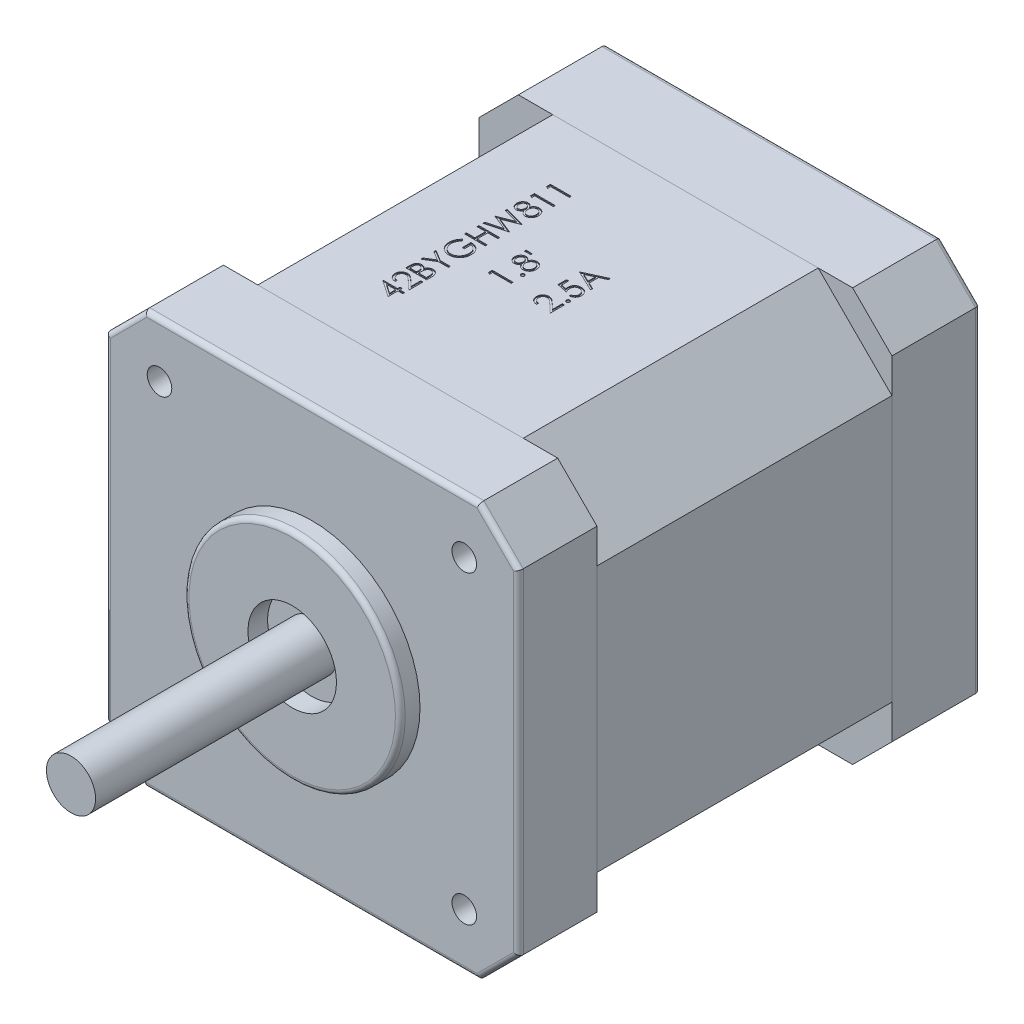
from build123d import *

# Parameters (mm, degrees)
IZIM1_R                     = 2.5
Y_KSEKLIK_EKSTR_ZYON1_DEPTH = 24.5
IZIM1_4_R                   = 11
IZIM1_4_R_2                 = 4.5
Y_KSEKLIK_EKSTR_ZYON2_DEPTH = 2
IZIM1_5_W                   = 42
IZIM1_5_H                   = 42
Y_KSEKLIK_EKSTR_ZYON3_DEPTH = 8
PAH1_SIZE                   = 4
Y_KSEKLIK_EKSTR_ZYON4_DEPTH = 30
Y_KSEKLIK_EKSTR_ZYON5_DEPTH = 9
IZIM4_R                     = 4.5
KES_EKSTR_ZYON1_DEPTH       = 3.5
M3_DI_LI_DELIK1_D           = 2.5
M3_DI_LI_DELIK1_DEPTH       = 7
M3_DI_LI_DELIK1_TIP         = 0.751075774
RADYUS1_R                   = 0.5
RADYUS2_R                   = 0.5
KES_EKSTR_ZYON2_DEPTH       = 0.1
IZIM11_R                    = 0.6


with BuildPart() as part:
    # Çizim1 → Yükseklik-Ekstrüzyon1 (new body)
    with BuildSketch(Plane.XY):
        Circle(IZIM1_R)
    extrude(amount=Y_KSEKLIK_EKSTR_ZYON1_DEPTH)



with BuildPart() as body_2:
    # Çizim1<4> → Yükseklik-Ekstrüzyon2 (new body)
    with BuildSketch(Plane.XY):
        Circle(IZIM1_4_R)
        Circle(IZIM1_4_R_2, mode=Mode.SUBTRACT)
    extrude(amount=Y_KSEKLIK_EKSTR_ZYON2_DEPTH)


with BuildPart() as part_1:
    add(part.part)

    add(body_2.part)  # Yükseklik-Ekstrüzyon3 merges body 2
    # Çizim1<5> → Yükseklik-Ekstrüzyon3 (add)
    with BuildSketch(Plane.XY):
        Rectangle(IZIM1_5_W, IZIM1_5_H)
    extrude(amount=-Y_KSEKLIK_EKSTR_ZYON3_DEPTH)

    # Pah1
    pah1_edges = [part_1.edges().sort_by_distance(p)[0] for p in [
        (21, -21, -4),
        (-21, -21, -4),
        (-21, 21, -4),
        (21, 21, -4),
    ]]
    chamfer(pah1_edges, length=PAH1_SIZE)

    # Çizim2 → Yükseklik-Ekstrüzyon4 (add)
    with BuildSketch(Plane(origin=(0, 0, -8), x_dir=(-1, 0, 0), z_dir=(0, 0, -1))):
        Polygon((-13.5, 21), (13.5, 21), (21, 13.5), (21, -13.5), (13.5, -21), (-13.5, -21), (-21, -13.5), (-21, 13.5), align=None)
    extrude(amount=Y_KSEKLIK_EKSTR_ZYON4_DEPTH)

    # Çizim3 → Yükseklik-Ekstrüzyon5 (add)
    with BuildSketch(Plane(origin=(0, 0, -38), x_dir=(-1, 0, 0), z_dir=(0, 0, -1))):
        Polygon((-17, -21), (17, -21), (21, -17), (21, 17), (17, 21), (-17, 21), (-21, 17), (-21, -17), align=None)
    extrude(amount=Y_KSEKLIK_EKSTR_ZYON5_DEPTH)

    # Çizim4 → Kes-Ekstrüzyon1 (cut)
    with BuildSketch(Plane(origin=(0, 0, -47), x_dir=(-1, 0, 0), z_dir=(0, 0, -1))):
        Circle(IZIM4_R)
    extrude(amount=-KES_EKSTR_ZYON1_DEPTH, mode=Mode.SUBTRACT)

    # M3 Dişli Delik1
    with Locations(Plane.XY):
        with Locations((-15.5, 15.5), (15.5, 15.5), (15.5, -15.5), (-15.5, -15.5)):
            Hole(M3_DI_LI_DELIK1_D / 2, depth=M3_DI_LI_DELIK1_DEPTH)
            with Locations((0, 0, -(M3_DI_LI_DELIK1_DEPTH + M3_DI_LI_DELIK1_TIP / 2))):  # 118° drill point
                Cone(0, M3_DI_LI_DELIK1_D / 2, M3_DI_LI_DELIK1_TIP, mode=Mode.SUBTRACT)

    # Radyus1
    radyus1_edges = [part_1.edges().sort_by_distance(p)[0] for p in [
        (-11, 0, 2),
    ]]
    fillet(radyus1_edges, radius=RADYUS1_R)

    # Radyus2
    radyus2_edges = [part_1.edges().sort_by_distance(p)[0] for p in [
        (4.5, 0, -47),
        (21, 0, -47),
        (19, -19, -47),
        (0, -21, -47),
        (-19, -19, -47),
        (-21, 0, -47),
        (-19, 19, -47),
        (0, 21, -47),
        (19, 19, -47),
        (19, -19, 0),
        (0, -21, 0),
        (-19, -19, 0),
        (-21, 0, 0),
        (-19, 19, 0),
        (0, 21, 0),
        (19, 19, 0),
        (21, 0, 0),
    ]]
    fillet(radyus2_edges, radius=RADYUS2_R)

    # Çizim9 → Kes-Ekstrüzyon2 (cut)
    # profile 1 of 18: a face of its own
    with BuildSketch(Plane(origin=(0, 21, 0), x_dir=(1, 0, 0), z_dir=(0, 1, 0))):
        Polygon((-7.48076484, 31.358758021), (-7.48076484, 31.750120868), (-5.364098173, 31.750120868), (-5.364098173, 31.560163603), (-7.263670823, 31.560163603), (-7.263670823, 31.234522577), align=None)
    # profile 2 of 18: a face of its own
    with BuildSketch(Plane(origin=(0, 21, 0), x_dir=(1, 0, 0), z_dir=(0, 1, 0))):
        Polygon((-7.48076484, 29.730552893), (-7.48076484, 30.12191574), (-5.364098173, 30.12191574), (-5.364098173, 29.931958475), (-7.263670823, 29.931958475), (-7.263670823, 29.606317449), align=None)
    # profile 3 of 18: a face of its own
    with BuildSketch(Plane(origin=(0, 21, 0), x_dir=(1, 0, 0), z_dir=(0, 1, 0))):
        with BuildLine():
            add(Edge.make_bspline(
                [(-6.543274856, 28.681547818), (-6.534253768, 28.698882093), (-6.516659635, 28.732689719), (-6.488152234, 28.780626515), (-6.45888197, 28.825043357), (-6.428289612, 28.865697076), (-6.397059915, 28.90310779), (-6.364791186, 28.936723711), (-6.331527054, 28.966686908), (-6.297144511, 28.992949637), (-6.261637512, 29.01619211), (-6.224780324, 29.035908924), (-6.187070227, 29.053109242), (-6.147944074, 29.066611163), (-6.107936156, 29.077758044), (-6.066510295, 29.085422119), (-6.023944767, 29.089545175), (-5.995177238, 29.09032454), (-5.980611261, 29.090719159)],
                knots=[0, 0, 0, 0, 1.272232798, 2.48127884, 3.629933602, 4.734339846, 5.792529071, 6.8014233, 7.765980239, 8.70477066, 9.616091719, 10.526157162, 11.424183119, 12.311964017, 13.218439077, 14.126407968, 15.05133675, 16, 16, 16, 16], degree=3))
            add(Edge.make_bspline(
                [(-5.980611261, 29.090719159), (-5.960232667, 29.090251116), (-5.919895782, 29.089324684), (-5.860351898, 29.081303416), (-5.802424948, 29.069151179), (-5.746227356, 29.051848089), (-5.69229116, 29.028724822), (-5.640304419, 29.000759187), (-5.589380456, 28.968920348), (-5.558040871, 28.943370755), (-5.542183109, 28.930442716)],
                knots=[0, 0, 0, 0, 1.025234619, 2.029323995, 3.018511574, 4.001747246, 4.983437759, 5.966776356, 6.971193253, 8, 8, 8, 8], degree=3))
            add(Edge.make_bspline(
                [(-5.542183109, 28.930442716), (-5.52368116, 28.913608277), (-5.486905895, 28.880147427), (-5.439159453, 28.822826323), (-5.399033867, 28.75991785), (-5.366333245, 28.69166543), (-5.340881321, 28.618251507), (-5.322591798, 28.539691723), (-5.312115853, 28.455832926), (-5.310601535, 28.398195807), (-5.309824669, 28.368627145)],
                knots=[0, 0, 0, 0, 0.954267603, 1.896743057, 2.838368354, 3.796610408, 4.779680527, 5.799409237, 6.871065594, 8, 8, 8, 8], degree=3))
            add(Edge.make_bspline(
                [(-5.309824669, 28.368627145), (-5.310521644, 28.340195238), (-5.311877886, 28.284869636), (-5.321066899, 28.204340824), (-5.33717042, 28.129275923), (-5.359210726, 28.059238455), (-5.387882644, 27.994650713), (-5.423568618, 27.935696505), (-5.464832628, 27.881526103), (-5.512858364, 27.833780322), (-5.564301308, 27.79140065), (-5.617358856, 27.754141293), (-5.671990135, 27.723346384), (-5.72736472, 27.69680369), (-5.784604471, 27.677050764), (-5.843122014, 27.663040688), (-5.902751097, 27.654240405), (-5.942985755, 27.653063411), (-5.963226779, 27.652471295)],
                knots=[0, 0, 0, 0, 1.25688423, 2.445769047, 3.576901867, 4.645929967, 5.686364546, 6.692558921, 7.686102643, 8.689032542, 9.678639083, 10.630214757, 11.550908986, 12.44815258, 13.341318614, 14.221806242, 15.105436345, 16, 16, 16, 16], degree=3))
            add(Edge.make_bspline(
                [(-5.963226779, 27.652471295), (-5.978079198, 27.652820878), (-6.00743282, 27.653511777), (-6.050800536, 27.658290847), (-6.093008186, 27.665981929), (-6.134225967, 27.676399487), (-6.174223055, 27.690664312), (-6.213255716, 27.707526057), (-6.251068002, 27.727571747), (-6.287940088, 27.750584344), (-6.323431869, 27.777375896), (-6.358116199, 27.807734631), (-6.391556957, 27.84206515), (-6.423561436, 27.880612719), (-6.45578492, 27.922023826), (-6.485840557, 27.968050041), (-6.516002545, 28.017229588), (-6.534028107, 28.052189265), (-6.543274856, 28.070122871)],
                knots=[0, 0, 0, 0, 0.941515718, 1.860767376, 2.762381872, 3.659935523, 4.55260077, 5.451495189, 6.353332278, 7.263234701, 8.204067976, 9.169206831, 10.183030162, 11.238523545, 12.34427893, 13.507326683, 14.721309093, 16, 16, 16, 16], degree=3))
            add(Edge.make_bspline(
                [(-6.543274856, 28.070122871), (-6.556702083, 28.045607178), (-6.582660298, 27.998212163), (-6.629722407, 27.934815616), (-6.681807098, 27.881200726), (-6.738380258, 27.837324513), (-6.798312673, 27.802960483), (-6.861105408, 27.779355845), (-6.925645395, 27.763394239), (-6.969735998, 27.761812626), (-6.99187929, 27.761018304)],
                knots=[0, 0, 0, 0, 1.166795445, 2.255709742, 3.287146686, 4.280506455, 5.237809939, 6.161201476, 7.076514059, 8, 8, 8, 8], degree=3))
            add(Edge.make_bspline(
                [(-6.99187929, 27.761018304), (-7.014434415, 27.762009081), (-7.059774151, 27.764000717), (-7.12728494, 27.780050579), (-7.193629536, 27.806401938), (-7.258645004, 27.841636061), (-7.319404266, 27.886451869), (-7.37415459, 27.939508983), (-7.422098209, 28.000380217), (-7.462366798, 28.068502961), (-7.495133403, 28.141824336), (-7.517738879, 28.219182273), (-7.532516797, 28.29923265), (-7.53418998, 28.353720296), (-7.535038344, 28.381347497)],
                knots=[0, 0, 0, 0, 0.888671842, 1.786385383, 2.719922424, 3.697584571, 4.694127107, 5.68736021, 6.695307759, 7.740011808, 8.800474061, 9.853175224, 10.911482437, 12, 12, 12, 12], degree=3))
            add(Edge.make_bspline(
                [(-7.535038344, 28.381347497), (-7.534163684, 28.408261743), (-7.532438953, 28.46133357), (-7.518053082, 28.539344116), (-7.49402796, 28.613988623), (-7.46142632, 28.684998614), (-7.421302427, 28.751143659), (-7.372657328, 28.809394746), (-7.318552835, 28.861275345), (-7.257447409, 28.903949476), (-7.192682004, 28.938908334), (-7.125097585, 28.963521739), (-7.05605486, 28.979196786), (-7.009345548, 28.981179011), (-6.985943125, 28.98217215)],
                knots=[0, 0, 0, 0, 1.072838999, 2.115516285, 3.151283082, 4.193045685, 5.225601509, 6.226687556, 7.21162948, 8.206378771, 9.189883966, 10.138656908, 11.067424936, 12, 12, 12, 12], degree=3))
            add(Edge.make_bspline(
                [(-6.985943125, 28.98217215), (-6.962978438, 28.981299209), (-6.917877096, 28.979584802), (-6.852222201, 28.965356673), (-6.790871353, 28.941012482), (-6.732836711, 28.908206273), (-6.679294483, 28.86507899), (-6.6291198, 28.813003892), (-6.582888678, 28.751435519), (-6.556755652, 28.705330977), (-6.543274856, 28.681547818)],
                knots=[0, 0, 0, 0, 0.97540661, 1.915643144, 2.83819279, 3.771804602, 4.738123289, 5.749225578, 6.838931607, 8, 8, 8, 8], degree=3))
        make_face()
        with BuildLine():
            add(Edge.make_bspline(
                [(-7.317944327, 28.370747204), (-7.317551636, 28.355899293), (-7.31678336, 28.326850286), (-7.312738607, 28.284264977), (-7.304969269, 28.243736491), (-7.294325381, 28.205043203), (-7.281082251, 28.168052565), (-7.263633977, 28.133612838), (-7.244240147, 28.10056665), (-7.221492068, 28.069998113), (-7.196673422, 28.042325825), (-7.170754255, 28.017609594), (-7.142970482, 27.997473536), (-7.114712088, 27.980149747), (-7.084806986, 27.967284414), (-7.053909957, 27.958145325), (-7.021825301, 27.951677521), (-6.999967843, 27.951211371), (-6.988911207, 27.950975569)],
                knots=[0, 0, 0, 0, 1.20353747, 2.354645537, 3.462130888, 4.543058862, 5.604822423, 6.639552563, 7.666902586, 8.706944258, 9.720926464, 10.677177239, 11.602682187, 12.496457588, 13.358248655, 14.231532794, 15.105417644, 16, 16, 16, 16], degree=3))
            add(Edge.make_bspline(
                [(-6.988911207, 27.950975569), (-6.977855852, 27.951391262), (-6.95600888, 27.952212732), (-6.923747333, 27.958565833), (-6.892044724, 27.968034503), (-6.861654887, 27.982942283), (-6.831523618, 28.000822891), (-6.802403978, 28.022891545), (-6.774194626, 28.049192053), (-6.747135497, 28.078841981), (-6.721796721, 28.111143244), (-6.699799607, 28.145363118), (-6.681394216, 28.181072126), (-6.666075957, 28.217903377), (-6.654168233, 28.256232248), (-6.645720528, 28.295823877), (-6.640469987, 28.336684919), (-6.639842836, 28.36437127), (-6.639525524, 28.378379415)],
                knots=[0, 0, 0, 0, 0.873023192, 1.725219244, 2.590779336, 3.480155217, 4.391973325, 5.357036234, 6.360879153, 7.436073238, 8.526419356, 9.601555421, 10.645666583, 11.697338044, 12.750135903, 13.812665442, 14.89329948, 16, 16, 16, 16], degree=3))
            add(Edge.make_bspline(
                [(-6.639525524, 28.378379415), (-6.640050738, 28.396372222), (-6.641095981, 28.432180121), (-6.650902959, 28.484947407), (-6.666134124, 28.536383319), (-6.68775201, 28.585514603), (-6.714109407, 28.631461924), (-6.745192156, 28.672929378), (-6.781730208, 28.708181629), (-6.821604083, 28.738172324), (-6.86390063, 28.761620801), (-6.906519974, 28.779582702), (-6.949813167, 28.790160676), (-6.978822936, 28.791535726), (-6.993151325, 28.792214885)],
                knots=[0, 0, 0, 0, 1.076561449, 2.142489767, 3.202892658, 4.283174188, 5.348766409, 6.369549039, 7.375093932, 8.378927502, 9.349008457, 10.26378795, 11.142457041, 12, 12, 12, 12], degree=3))
            add(Edge.make_bspline(
                [(-6.993151325, 28.792214885), (-7.003208953, 28.791898332), (-7.023171904, 28.791270019), (-7.052756886, 28.785909047), (-7.081652838, 28.777481166), (-7.109919491, 28.765419305), (-7.137420534, 28.749929571), (-7.164886329, 28.731822333), (-7.191047006, 28.709350684), (-7.216810805, 28.684346216), (-7.240584431, 28.655928371), (-7.261647889, 28.624368631), (-7.278821837, 28.589299222), (-7.293409146, 28.551471745), (-7.304213397, 28.51047856), (-7.312352627, 28.466704923), (-7.316928715, 28.419746571), (-7.317598447, 28.387434571), (-7.317944327, 28.370747204)],
                knots=[0, 0, 0, 0, 0.814197944, 1.616066217, 2.427603245, 3.248455667, 4.099186941, 4.981981106, 5.90846497, 6.888109974, 7.887887681, 8.904052014, 9.953721043, 11.044545063, 12.183287691, 13.382474488, 14.648192314, 16, 16, 16, 16], degree=3))
        make_face(mode=Mode.SUBTRACT)
        with BuildLine():
            add(Edge.make_bspline(
                [(-6.422431507, 28.383043544), (-6.422096465, 28.364219972), (-6.421439194, 28.327292717), (-6.414131048, 28.273190915), (-6.403941903, 28.221276233), (-6.388542964, 28.17168812), (-6.368341665, 28.124639004), (-6.344792295, 28.079324212), (-6.316131377, 28.03684936), (-6.283567863, 27.997301237), (-6.248453816, 27.96101112), (-6.210896371, 27.929614833), (-6.172350331, 27.90254782), (-6.131936601, 27.880901426), (-6.090547428, 27.863107984), (-6.04711952, 27.851429365), (-6.002496261, 27.84394093), (-5.972161293, 27.842935494), (-5.956866603, 27.84242856)],
                knots=[0, 0, 0, 0, 1.140120093, 2.236637429, 3.303440304, 4.343881959, 5.376465234, 6.40341898, 7.434544382, 8.475444373, 9.50525236, 10.49018835, 11.438301835, 12.354413346, 13.264416842, 14.162243115, 15.073415118, 16, 16, 16, 16], degree=3))
            add(Edge.make_bspline(
                [(-5.956866603, 27.84242856), (-5.937862927, 27.84327052), (-5.900022071, 27.844947062), (-5.844216202, 27.857702001), (-5.790358932, 27.878811974), (-5.738701029, 27.907713215), (-5.690391775, 27.943721779), (-5.648173451, 27.987785079), (-5.611265075, 28.037810207), (-5.580842584, 28.094558127), (-5.556856718, 28.156851216), (-5.539481752, 28.22412554), (-5.528641199, 28.295910184), (-5.527501905, 28.345408413), (-5.526918686, 28.370747204)],
                knots=[0, 0, 0, 0, 0.898929492, 1.789983246, 2.69439732, 3.628772362, 4.584083338, 5.535003999, 6.506411961, 7.518169435, 8.572915583, 9.658441722, 10.801325702, 12, 12, 12, 12], degree=3))
            add(Edge.make_bspline(
                [(-5.526918686, 28.370747204), (-5.527303848, 28.390551827), (-5.528054268, 28.429137584), (-5.534526719, 28.485453906), (-5.545131095, 28.538463206), (-5.559367314, 28.588598373), (-5.578594462, 28.635440763), (-5.602096835, 28.679192087), (-5.629096435, 28.72040248), (-5.661048106, 28.757216478), (-5.695208648, 28.790738885), (-5.731366391, 28.819969399), (-5.768544766, 28.845343631), (-5.807582375, 28.865259043), (-5.847730669, 28.881180152), (-5.889359759, 28.892624399), (-5.932597353, 28.899685729), (-5.961927744, 28.90039989), (-5.976795155, 28.900761894)],
                knots=[0, 0, 0, 0, 1.224881218, 2.3864614, 3.501053153, 4.5663711, 5.605533372, 6.626474706, 7.635288001, 8.646258782, 9.635558885, 10.592810877, 11.51917626, 12.414699553, 13.29797396, 14.186770504, 15.080884095, 16, 16, 16, 16], degree=3))
            add(Edge.make_bspline(
                [(-5.976795155, 28.900761894), (-5.991235286, 28.9002141), (-6.019708703, 28.899133948), (-6.061900474, 28.892277522), (-6.102664524, 28.880234786), (-6.142482785, 28.863702022), (-6.18058093, 28.84172416), (-6.21791194, 28.8156582), (-6.253837174, 28.784686123), (-6.287855769, 28.749188827), (-6.319293601, 28.710694649), (-6.34723457, 28.669905409), (-6.370070277, 28.626627756), (-6.389254068, 28.581720958), (-6.404204071, 28.534731794), (-6.414687222, 28.485887048), (-6.421275872, 28.43509415), (-6.422041943, 28.400589761), (-6.422431507, 28.383043544)],
                knots=[0, 0, 0, 0, 0.917285732, 1.808727228, 2.70647511, 3.61182169, 4.540502712, 5.494399442, 6.50027777, 7.547876848, 8.61347749, 9.654284431, 10.682470341, 11.71628462, 12.752590585, 13.809114363, 14.885888007, 16, 16, 16, 16], degree=3))
        make_face(mode=Mode.SUBTRACT)
    # profile 4 of 18: a face of its own
    with BuildSketch(Plane(origin=(0, 21, 0), x_dir=(1, 0, 0), z_dir=(0, 1, 0))):
        Polygon((-7.48076484, 24.884522577), (-7.48076484, 25.080840019), (-5.928457815, 25.495099501), (-7.48076484, 26.111188576), (-7.48076484, 26.13874934), (-5.939058109, 26.743390099), (-7.48076484, 27.159769639), (-7.48076484, 27.353967022), (-5.364098173, 26.783247204), (-5.364098173, 26.756110451), (-6.982975043, 26.1192448), (-5.364098173, 25.474746936), (-5.364098173, 25.447610184), align=None)
    # profile 5 of 18: a face of its own
    with BuildSketch(Plane(origin=(0, 21, 0), x_dir=(1, 0, 0), z_dir=(0, 1, 0))):
        Polygon((-7.48076484, 23.01208668), (-7.48076484, 23.202043945), (-6.612388771, 23.202043945), (-6.612388771, 24.28751403), (-7.48076484, 24.28751403), (-7.48076484, 24.477471295), (-5.364098173, 24.477471295), (-5.364098173, 24.28751403), (-6.395294754, 24.28751403), (-6.395294754, 23.202043945), (-5.364098173, 23.202043945), (-5.364098173, 23.01208668), align=None)
    # profile 6 of 18: a face of its own
    with BuildSketch(Plane(origin=(0, 21, 0), x_dir=(1, 0, 0), z_dir=(0, 1, 0))):
        with BuildLine():
            Line((-7.119506827, 22.442214885), (-6.965166549, 22.279394372))
            add(Edge.make_bspline(
                [(-6.965166549, 22.279394372), (-6.992892598, 22.249936976), (-7.047683552, 22.191724612), (-7.118660066, 22.096656075), (-7.180063313, 21.997864678), (-7.229651122, 21.895190682), (-7.268550412, 21.791326453), (-7.296826638, 21.688057943), (-7.314733735, 21.586053782), (-7.316884521, 21.518221085), (-7.317944327, 21.484796349)],
                knots=[0, 0, 0, 0, 1.089067066, 2.152164705, 3.18986567, 4.218445106, 5.218487318, 6.173592265, 7.100032889, 8, 8, 8, 8], degree=3))
            add(Edge.make_bspline(
                [(-7.317944327, 21.484796349), (-7.317694194, 21.46428603), (-7.317194577, 21.423318588), (-7.310817837, 21.362466269), (-7.301646705, 21.30225216), (-7.288377093, 21.242789929), (-7.271559234, 21.18396396), (-7.250522309, 21.125978851), (-7.225996049, 21.068726422), (-7.197655383, 21.01274602), (-7.166522435, 20.958474243), (-7.132021276, 20.907217045), (-7.095259902, 20.858644709), (-7.055309768, 20.813681141), (-7.012562595, 20.772027249), (-6.96778822, 20.732916873), (-6.920106329, 20.697078938), (-6.869713, 20.665156194), (-6.817780612, 20.636328649), (-6.764749602, 20.611417175), (-6.711112269, 20.589760679), (-6.656464735, 20.573266427), (-6.601370392, 20.559295898), (-6.54554052, 20.549570579), (-6.488829325, 20.544069473), (-6.45085167, 20.5431197), (-6.431759765, 20.542642236)],
                knots=[0, 0, 0, 0, 1.028150113, 2.053633673, 3.06513288, 4.081487945, 5.106702018, 6.131327874, 7.172780699, 8.228344599, 9.276313556, 10.308389736, 11.324843658, 12.329040066, 13.321460474, 14.316307835, 15.308626991, 16.309440696, 17.305625405, 18.28535951, 19.246194545, 20.203493668, 21.145557131, 22.095268976, 23.042464743, 24, 24, 24, 24], degree=3))
            add(Edge.make_bspline(
                [(-6.431759765, 20.542642236), (-6.412243699, 20.543099554), (-6.373264857, 20.544012941), (-6.315088938, 20.549850827), (-6.257783767, 20.560709454), (-6.20125921, 20.575109893), (-6.145402774, 20.593417654), (-6.090272749, 20.615910269), (-6.035874495, 20.642704931), (-5.982748026, 20.673651364), (-5.931040803, 20.707826138), (-5.88192659, 20.745412807), (-5.835976951, 20.78647465), (-5.792520731, 20.830258773), (-5.751832181, 20.877164104), (-5.714401742, 20.927645716), (-5.679650624, 20.98099696), (-5.647960595, 21.037241504), (-5.619653282, 21.095784863), (-5.594480545, 21.155811371), (-5.573749759, 21.217513959), (-5.556853844, 21.280568048), (-5.543004621, 21.344898554), (-5.534094977, 21.410831996), (-5.52762957, 21.477883587), (-5.527156845, 21.523082664), (-5.526918686, 21.545854041)],
                knots=[0, 0, 0, 0, 0.935915162, 1.869274651, 2.799799983, 3.730201895, 4.664668062, 5.616159355, 6.583070886, 7.570012957, 8.562524459, 9.553461134, 10.53281078, 11.515274572, 12.509912756, 13.507571325, 14.526460018, 15.561318395, 16.601025881, 17.643204557, 18.680545676, 19.719612342, 20.772381578, 21.833430283, 22.908478249, 24, 24, 24, 24], degree=3))
            add(Edge.make_bspline(
                [(-5.526918686, 21.545854041), (-5.527492111, 21.573297249), (-5.528618124, 21.627186445), (-5.537390722, 21.70640047), (-5.55107435, 21.782487148), (-5.571176061, 21.855198783), (-5.596619876, 21.924799256), (-5.628084779, 21.991031865), (-5.665239708, 22.054079499), (-5.707332282, 22.113669267), (-5.75423064, 22.168384508), (-5.804386392, 22.21818186), (-5.858449343, 22.261348932), (-5.915613767, 22.299175166), (-5.976426451, 22.33043969), (-6.040549091, 22.35610934), (-6.108021364, 22.37578373), (-6.154643379, 22.383860379), (-6.178200737, 22.387941381)],
                knots=[0, 0, 0, 0, 1.130199668, 2.219330667, 3.279027493, 4.311506524, 5.322739849, 6.327972234, 7.327472899, 8.33386792, 9.329086447, 10.29244429, 11.240784345, 12.174119183, 13.111530729, 14.052100829, 15.015757696, 16, 16, 16, 16], degree=3))
            Line((-6.178200737, 22.387941381), (-6.178200737, 21.682385825))
            Line((-6.178200737, 21.682385825), (-6.395294754, 21.682385825))
            Line((-6.395294754, 21.682385825), (-6.395294754, 22.577898646))
            add(Edge.make_bspline(
                [(-6.395294754, 22.577898646), (-6.354831654, 22.576867014), (-6.275638057, 22.574847923), (-6.160146513, 22.560685055), (-6.051064584, 22.537815069), (-5.948277393, 22.506572881), (-5.851930601, 22.466129259), (-5.761926387, 22.416918254), (-5.678846204, 22.358152256), (-5.602011806, 22.291924513), (-5.533474616, 22.217599301), (-5.473236739, 22.137184945), (-5.422495634, 22.050548588), (-5.381214185, 21.95777218), (-5.348996103, 21.859159442), (-5.326153292, 21.754482184), (-5.312467552, 21.643882359), (-5.310718956, 21.568083511), (-5.309824669, 21.529317583)],
                knots=[0, 0, 0, 0, 1.140356446, 2.231883559, 3.274166699, 4.278491846, 5.25512956, 6.21435461, 7.1637429, 8.11826594, 9.068280886, 10.0076534, 10.945064095, 11.891975133, 12.864533718, 13.863980011, 14.907571808, 16, 16, 16, 16], degree=3))
            add(Edge.make_bspline(
                [(-5.309824669, 21.529317583), (-5.310168852, 21.505423358), (-5.310847691, 21.458296246), (-5.315672087, 21.388693637), (-5.323098912, 21.321010124), (-5.334314296, 21.255255566), (-5.348051254, 21.191188092), (-5.365641793, 21.129127677), (-5.38600334, 21.068837909), (-5.409163104, 21.010225603), (-5.435997392, 20.953822758), (-5.465817983, 20.89937815), (-5.498471111, 20.846590827), (-5.53452148, 20.79582036), (-5.573699444, 20.746802218), (-5.616083528, 20.699852469), (-5.661544157, 20.654708276), (-5.693825749, 20.626429329), (-5.710091763, 20.612180163)],
                knots=[0, 0, 0, 0, 1.107784379, 2.184907829, 3.233506516, 4.263428166, 5.276301166, 6.270063455, 7.25232949, 8.225834625, 9.190232166, 10.146266622, 11.1027726, 12.066435141, 13.031522626, 14.010570082, 14.99756817, 16, 16, 16, 16], degree=3))
            add(Edge.make_bspline(
                [(-5.710091763, 20.612180163), (-5.735897348, 20.591505814), (-5.787080173, 20.550500288), (-5.869085854, 20.497717784), (-5.95399555, 20.45272265), (-6.042045635, 20.41621449), (-6.133153749, 20.387707172), (-6.227203473, 20.367262438), (-6.324315916, 20.355283744), (-6.390032529, 20.353558033), (-6.42327953, 20.352684971)],
                knots=[0, 0, 0, 0, 1.023165419, 2.029347347, 3.013907458, 3.994755782, 4.975994455, 5.96558838, 6.970761222, 8, 8, 8, 8], degree=3))
            add(Edge.make_bspline(
                [(-6.42327953, 20.352684971), (-6.448175311, 20.353006848), (-6.497650464, 20.353646512), (-6.571103216, 20.361402896), (-6.643251733, 20.372531369), (-6.714037019, 20.38888841), (-6.783506423, 20.409508485), (-6.851691924, 20.43524339), (-6.918634805, 20.46520558), (-6.983870343, 20.500033647), (-7.046547633, 20.538779978), (-7.106359958, 20.580876037), (-7.162337941, 20.626646646), (-7.214611255, 20.676225084), (-7.263954658, 20.728611938), (-7.309337443, 20.784906986), (-7.351469775, 20.844257313), (-7.389542083, 20.907123003), (-7.423752166, 20.972512056), (-7.453741147, 21.040282332), (-7.47852648, 21.110409202), (-7.499556287, 21.182368344), (-7.515107838, 21.256704153), (-7.526385885, 21.332877267), (-7.534103011, 21.411284715), (-7.534723651, 21.464283647), (-7.535038344, 21.491156525)],
                knots=[0, 0, 0, 0, 1.00895651, 2.005089799, 2.991467152, 3.967318338, 4.948153826, 5.927364234, 6.919980553, 7.91976625, 8.923240147, 9.905815003, 10.88314567, 11.851989312, 12.825009789, 13.798721852, 14.781296708, 15.773896486, 16.776076962, 17.771600213, 18.775744723, 19.78957137, 20.808953803, 21.851964491, 22.910847925, 24, 24, 24, 24], degree=3))
            add(Edge.make_bspline(
                [(-7.535038344, 21.491156525), (-7.53468789, 21.513072034), (-7.533992979, 21.556527914), (-7.529176264, 21.621192523), (-7.521541821, 21.684857632), (-7.511123717, 21.74761764), (-7.496933771, 21.809258823), (-7.479953094, 21.869956783), (-7.460182325, 21.929799507), (-7.436603356, 21.988599448), (-7.40984045, 22.046751972), (-7.379715189, 22.104580418), (-7.345712449, 22.1618872), (-7.307731263, 22.218771699), (-7.266423958, 22.275592622), (-7.220609117, 22.331451239), (-7.17209345, 22.387695877), (-7.137209463, 22.423861736), (-7.119506827, 22.442214885)],
                knots=[0, 0, 0, 0, 0.985871117, 1.954866573, 2.915460327, 3.869826059, 4.81536089, 5.759505086, 6.70452669, 7.649098992, 8.607881297, 9.583363685, 10.581137262, 11.603961102, 12.659522466, 13.73993555, 14.853081303, 16, 16, 16, 16], degree=3))
        make_face()
    # profile 7 of 18: a face of its own
    with BuildSketch(Plane(origin=(0, 21, 0), x_dir=(1, 0, 0), z_dir=(0, 1, 0))):
        Polygon((-7.48076484, 18.56165933), (-7.48076484, 18.779177358), (-6.571259632, 19.335480777), (-7.48076484, 19.890936173), (-7.48076484, 20.108454201), (-6.370278061, 19.430035398), (-5.364098173, 19.430035398), (-5.364098173, 19.240078133), (-6.370278061, 19.240078133), align=None)
    # profile 8 of 18: a face of its own
    with BuildSketch(Plane(origin=(0, 21, 0), x_dir=(1, 0, 0), z_dir=(0, 1, 0))):
        with BuildLine():
            Line((-7.48076484, 17.04200121), (-7.48076484, 17.454988657))
            add(Edge.make_bspline(
                [(-7.48076484, 17.454988657), (-7.480660226, 17.475205245), (-7.480457458, 17.514390026), (-7.477239682, 17.571366023), (-7.472961952, 17.624750551), (-7.46578629, 17.674449275), (-7.458346076, 17.720785576), (-7.447425622, 17.763289045), (-7.435363583, 17.802315699), (-7.4168045, 17.849178722), (-7.387982009, 17.902351244), (-7.345235516, 17.959501755), (-7.293985922, 18.009180467), (-7.235582968, 18.051422097), (-7.1713331, 18.085321904), (-7.102618675, 18.109536652), (-7.030595732, 18.125093129), (-6.981217344, 18.126672903), (-6.956262302, 18.127471295)],
                knots=[0, 0, 0, 0, 1.00128172, 1.940733171, 2.826250472, 3.653024905, 4.427672124, 5.149348099, 5.824709082, 6.450061444, 7.643590664, 8.808605388, 9.972104426, 11.165284501, 12.367876273, 13.557044126, 14.765369432, 16, 16, 16, 16], degree=3))
            add(Edge.make_bspline(
                [(-6.956262302, 18.127471295), (-6.932887737, 18.126806293), (-6.886954512, 18.1254995), (-6.819887722, 18.113155722), (-6.756111126, 18.093564384), (-6.695679307, 18.066488363), (-6.639717207, 18.031602426), (-6.588398183, 17.989804169), (-6.543661811, 17.939583898), (-6.518661067, 17.901938613), (-6.505961822, 17.882816514)],
                knots=[0, 0, 0, 0, 1.044641374, 2.052818814, 3.038628718, 4.023282556, 5.005660861, 5.98021751, 6.974042014, 8, 8, 8, 8], degree=3))
            add(Edge.make_bspline(
                [(-6.505961822, 17.882816514), (-6.496727143, 17.906859784), (-6.479058914, 17.952860516), (-6.447870534, 18.016200751), (-6.413825436, 18.070573374), (-6.377220876, 18.117040527), (-6.337183141, 18.156572045), (-6.293386943, 18.190808626), (-6.245868137, 18.220406817), (-6.194801369, 18.245594673), (-6.140619556, 18.265380048), (-6.083984474, 18.279922025), (-6.025113235, 18.28852392), (-5.985162033, 18.28969735), (-5.964922826, 18.290291808)],
                knots=[0, 0, 0, 0, 1.272586185, 2.434772614, 3.483318042, 4.437947805, 5.351807173, 6.25737843, 7.180033415, 8.1141739, 9.066731021, 10.025721652, 10.999834114, 12, 12, 12, 12], degree=3))
            add(Edge.make_bspline(
                [(-5.964922826, 18.290291808), (-5.944259919, 18.289701178), (-5.903605071, 18.288539097), (-5.843882929, 18.279961746), (-5.786804143, 18.265448731), (-5.73202582, 18.245423622), (-5.679662811, 18.219467749), (-5.62990481, 18.18742377), (-5.582648296, 18.149741519), (-5.537809868, 18.107154484), (-5.496781296, 18.059694565), (-5.461510561, 18.007390681), (-5.431182755, 17.951675701), (-5.406490937, 17.891837364), (-5.387441216, 17.828028424), (-5.3741688, 17.760284388), (-5.365210861, 17.68871682), (-5.364475362, 17.639603897), (-5.364098173, 17.614417075)],
                knots=[0, 0, 0, 0, 0.978680899, 1.925582087, 2.851223405, 3.764209995, 4.683484765, 5.614004905, 6.562443559, 7.542772147, 8.539900013, 9.527881485, 10.525548727, 11.540192123, 12.58875426, 13.674701727, 14.807505862, 16, 16, 16, 16], degree=3))
            Line((-5.364098173, 17.614417075), (-5.364098173, 17.04200121))
            Line((-5.364098173, 17.04200121), (-7.48076484, 17.04200121))
        make_face()
        with BuildLine():
            Line((-7.263670823, 17.231958475), (-6.585252019, 17.231958475))
            Line((-6.585252019, 17.231958475), (-6.585252019, 17.359586012))
            add(Edge.make_bspline(
                [(-6.585252019, 17.359586012), (-6.585493878, 17.378242189), (-6.585961197, 17.414289723), (-6.587299848, 17.466492708), (-6.591048187, 17.514949268), (-6.594795456, 17.559575751), (-6.600888165, 17.600301916), (-6.608140601, 17.637037424), (-6.615810555, 17.670359169), (-6.628855733, 17.708784566), (-6.64812889, 17.752377644), (-6.678068296, 17.798819265), (-6.71369997, 17.83995143), (-6.755198561, 17.874268706), (-6.800397825, 17.902602741), (-6.848900952, 17.922451624), (-6.899731882, 17.935684283), (-6.934694763, 17.936897867), (-6.952446197, 17.93751403)],
                knots=[0, 0, 0, 0, 1.156917035, 2.235399477, 3.236897345, 4.169954739, 5.01148057, 5.788325709, 6.491867502, 7.129259015, 8.302032419, 9.437271567, 10.542795419, 11.662606952, 12.764338259, 13.836858145, 14.901724648, 16, 16, 16, 16], degree=3))
            add(Edge.make_bspline(
                [(-6.952446197, 17.93751403), (-6.964195703, 17.93720118), (-6.987243644, 17.936587491), (-7.020951375, 17.931378784), (-7.052624278, 17.922939295), (-7.082566334, 17.911509952), (-7.110033411, 17.895895774), (-7.136337957, 17.87779689), (-7.159904457, 17.855451248), (-7.181867496, 17.830198689), (-7.201524343, 17.801305257), (-7.217806993, 17.768148443), (-7.232564485, 17.731585401), (-7.243489017, 17.690624156), (-7.25309543, 17.646113438), (-7.259131204, 17.597450557), (-7.263015282, 17.544943879), (-7.263447435, 17.508563345), (-7.263670823, 17.48975762)],
                knots=[0, 0, 0, 0, 0.911708768, 1.788416306, 2.640049961, 3.452993646, 4.268229297, 5.087074648, 5.92553149, 6.781184137, 7.681934069, 8.628939405, 9.643570426, 10.73771997, 11.914765019, 13.176320755, 14.540391495, 16, 16, 16, 16], degree=3))
            Line((-7.263670823, 17.48975762), (-7.263670823, 17.231958475))
        make_face(mode=Mode.SUBTRACT)
        with BuildLine():
            Line((-6.368158002, 17.231958475), (-5.58119219, 17.231958475))
            Line((-5.58119219, 17.231958475), (-5.58119219, 17.502477973))
            add(Edge.make_bspline(
                [(-5.58119219, 17.502477973), (-5.581447342, 17.521839774), (-5.581939114, 17.559157094), (-5.583092421, 17.613079323), (-5.587455206, 17.662926475), (-5.591479856, 17.708855801), (-5.598361834, 17.750745405), (-5.604856632, 17.788917502), (-5.614497695, 17.822745472), (-5.627748203, 17.862332024), (-5.648960621, 17.906580638), (-5.679951763, 17.954936409), (-5.718199616, 17.997101892), (-5.761699306, 18.033297023), (-5.808866245, 18.063166817), (-5.859083813, 18.08460122), (-5.911375377, 18.097921322), (-5.947037744, 18.099528517), (-5.964922826, 18.100334543)],
                knots=[0, 0, 0, 0, 1.160376723, 2.23647316, 3.230273494, 4.158083346, 4.997711197, 5.773399541, 6.476071462, 7.102777513, 8.27340052, 9.405620712, 10.53304798, 11.669441455, 12.787990954, 13.865552736, 14.929550474, 16, 16, 16, 16], degree=3))
            add(Edge.make_bspline(
                [(-5.964922826, 18.100334543), (-5.976107135, 18.100168077), (-5.998295348, 18.09983783), (-6.03089807, 18.09483467), (-6.062495263, 18.087596683), (-6.093218598, 18.078064045), (-6.122551502, 18.064737931), (-6.150606468, 18.048401233), (-6.177948654, 18.029700979), (-6.212962691, 18.000850025), (-6.252803808, 17.958273376), (-6.291328897, 17.897767207), (-6.322899835, 17.82934941), (-6.336246676, 17.779610683), (-6.343141309, 17.753916942)],
                knots=[0, 0, 0, 0, 0.723302347, 1.434937762, 2.129609326, 2.821140842, 3.513216847, 4.209993937, 4.920569932, 5.655069131, 7.14393391, 8.6716197, 10.280644748, 12, 12, 12, 12], degree=3))
            add(Edge.make_bspline(
                [(-6.343141309, 17.753916942), (-6.345230812, 17.743618393), (-6.349761286, 17.721289016), (-6.354543564, 17.684877765), (-6.358804147, 17.64330893), (-6.361955657, 17.596486523), (-6.365213233, 17.544351305), (-6.366480101, 17.486791931), (-6.367991559, 17.424043459), (-6.368101102, 17.380505215), (-6.368158002, 17.357889965)],
                knots=[0, 0, 0, 0, 0.634451884, 1.375622551, 2.216452059, 3.157844607, 4.20941857, 5.370758133, 6.634282058, 8, 8, 8, 8], degree=3))
            Line((-6.368158002, 17.357889965), (-6.368158002, 17.231958475))
        make_face(mode=Mode.SUBTRACT)
    # profile 9 of 18: a face of its own
    with BuildSketch(Plane(origin=(0, 21, 0), x_dir=(1, 0, 0), z_dir=(0, 1, 0))):
        with BuildLine():
            Line((-6.829482789, 15.495206338), (-6.829482789, 15.305249073))
            add(Edge.make_bspline(
                [(-6.829482789, 15.305249073), (-6.854683754, 15.306487113), (-6.90417778, 15.308918591), (-6.976340332, 15.320305223), (-7.04531633, 15.33659804), (-7.110551944, 15.3596343), (-7.172623985, 15.388243334), (-7.231285899, 15.422551494), (-7.286313904, 15.463187775), (-7.337197871, 15.509274705), (-7.383877973, 15.559330024), (-7.424188525, 15.613338854), (-7.458247307, 15.670092752), (-7.486720249, 15.729419531), (-7.508092441, 15.791988539), (-7.52395029, 15.857231981), (-7.533491223, 15.925436507), (-7.534516769, 15.971906425), (-7.535038344, 15.995540206)],
                knots=[0, 0, 0, 0, 1.10065271, 2.161652631, 3.183658789, 4.190468796, 5.17591951, 6.163126047, 7.15150782, 8.156236427, 9.156009102, 10.134482811, 11.092018607, 12.041330605, 13.001268258, 13.972401359, 14.968799086, 16, 16, 16, 16], degree=3))
            add(Edge.make_bspline(
                [(-7.535038344, 15.995540206), (-7.534499401, 16.018751436), (-7.533440398, 16.064360675), (-7.524209208, 16.130898882), (-7.510063232, 16.19439229), (-7.489101124, 16.254121328), (-7.462798265, 16.310698983), (-7.430087212, 16.363424731), (-7.392515745, 16.413573536), (-7.348198356, 16.458684181), (-7.30091159, 16.50012375), (-7.250409722, 16.535842153), (-7.198189236, 16.566603123), (-7.143842213, 16.591780016), (-7.087191673, 16.610865221), (-7.028780744, 16.625005528), (-6.967935325, 16.633088892), (-6.92674589, 16.634322668), (-6.905804904, 16.634949928)],
                knots=[0, 0, 0, 0, 1.111674182, 2.184400057, 3.212814286, 4.223731311, 5.211378316, 6.196328225, 7.191884489, 8.207283132, 9.220262353, 10.201199469, 11.166417575, 12.120932471, 13.06540007, 14.026332106, 14.996573967, 16, 16, 16, 16], degree=3))
            add(Edge.make_bspline(
                [(-6.905804904, 16.634949928), (-6.876324083, 16.633925891), (-6.817879789, 16.631895787), (-6.731994424, 16.614530662), (-6.648783874, 16.587408303), (-6.581811889, 16.554755653), (-6.527851981, 16.521806316), (-6.483402122, 16.492143878), (-6.43555417, 16.457221605), (-6.384114459, 16.417337857), (-6.329756637, 16.37180578), (-6.271371658, 16.321808292), (-6.2100391, 16.266054189), (-6.168120845, 16.22695716), (-6.146399856, 16.206698058)],
                knots=[0, 0, 0, 0, 1.184416499, 2.348048165, 3.509039915, 4.696071444, 5.333504901, 6.05069495, 6.844171097, 7.714965912, 8.667477798, 9.695072654, 10.805644396, 12, 12, 12, 12], degree=3))
            Line((-6.146399856, 16.206698058), (-5.58119219, 15.67710738))
            Line((-5.58119219, 15.67710738), (-5.58119219, 16.66208668))
            Line((-5.58119219, 16.66208668), (-5.364098173, 16.66208668))
            Line((-5.364098173, 16.66208668), (-5.364098173, 15.223838817))
            Line((-5.364098173, 15.223838817), (-6.240106453, 16.044725569))
            add(Edge.make_bspline(
                [(-6.240106453, 16.044725569), (-6.260969715, 16.064711672), (-6.30104377, 16.103100885), (-6.359550227, 16.157397968), (-6.41382733, 16.206165356), (-6.463772529, 16.249718731), (-6.510116382, 16.28711328), (-6.551357941, 16.320297915), (-6.589309441, 16.34688663), (-6.633300194, 16.375743084), (-6.6870105, 16.403691539), (-6.75264754, 16.427708059), (-6.820215927, 16.442352277), (-6.865876682, 16.444109011), (-6.888844434, 16.444992663)],
                knots=[0, 0, 0, 0, 1.329631726, 2.553950428, 3.673215718, 4.687767853, 5.603093632, 6.413772471, 7.123043292, 7.734684054, 8.834405432, 9.900288307, 10.943827018, 12, 12, 12, 12], degree=3))
            add(Edge.make_bspline(
                [(-6.888844434, 16.444992663), (-6.903286994, 16.44460819), (-6.931750506, 16.443850468), (-6.97348256, 16.437163194), (-7.013738424, 16.427057317), (-7.052641922, 16.412576137), (-7.089801912, 16.393461584), (-7.125263626, 16.37019435), (-7.159546953, 16.343348931), (-7.191692042, 16.312293639), (-7.221132581, 16.278178101), (-7.247212385, 16.242137769), (-7.269007466, 16.204007468), (-7.286874248, 16.163947965), (-7.300889836, 16.122070943), (-7.310601453, 16.078295407), (-7.316698955, 16.032742312), (-7.317523954, 16.001637293), (-7.317944327, 15.985787935)],
                knots=[0, 0, 0, 0, 0.991446411, 1.95395049, 2.89581595, 3.838931463, 4.798493298, 5.75982156, 6.748411868, 7.785213223, 8.824556874, 9.840280684, 10.836137867, 11.835679398, 12.848801643, 13.863922112, 14.911575587, 16, 16, 16, 16], degree=3))
            add(Edge.make_bspline(
                [(-7.317944327, 15.985787935), (-7.317528966, 15.969230944), (-7.316713264, 15.936715746), (-7.310534735, 15.889077568), (-7.301168082, 15.84331902), (-7.286291792, 15.800122861), (-7.268714717, 15.758553706), (-7.246384937, 15.719498989), (-7.220437237, 15.682310283), (-7.19034982, 15.647599271), (-7.156544432, 15.615897069), (-7.119288561, 15.587650865), (-7.078850419, 15.563133164), (-7.035395973, 15.541711821), (-6.988492577, 15.524323493), (-6.938317387, 15.511034396), (-6.885085264, 15.500519654), (-6.848324781, 15.49700686), (-6.829482789, 15.495206338)],
                knots=[0, 0, 0, 0, 1.030878251, 2.024474673, 2.987898669, 3.934362936, 4.864849709, 5.795128259, 6.730474222, 7.685293701, 8.650606017, 9.611896181, 10.591709709, 11.591680886, 12.625074257, 13.701333388, 14.821793024, 16, 16, 16, 16], degree=3))
        make_face()
    # profile 10 of 18: a face of its own
    with BuildSketch(Plane(origin=(0, 21, 0), x_dir=(1, 0, 0), z_dir=(0, 1, 0))):
        Polygon((-7.535038344, 14.751065713), (-7.535038344, 14.789650783), (-6.069653729, 14.789650783), (-6.069653729, 15.033881552), (-5.852559712, 15.033881552), (-5.852559712, 14.789650783), (-5.364098173, 14.789650783), (-5.364098173, 14.599693518), (-5.852559712, 14.599693518), (-5.852559712, 13.595633689), align=None)
        Polygon((-6.069653729, 14.599693518), (-6.988911207, 14.599693518), (-6.069653729, 13.96876403), align=None, mode=Mode.SUBTRACT)
    # profile 11 of 18: a face of its own
    with BuildSketch(Plane(origin=(0, 21, 0), x_dir=(1, 0, 0), z_dir=(0, 1, 0))):
        Polygon((-2.274568259, 24.692021242), (-2.274568259, 24.560153587), (-2.92585031, 24.5317448), (-2.92585031, 24.721702065), align=None)
    # profile 12 of 18: a face of its own
    with BuildSketch(Plane(origin=(0, 21, 0), x_dir=(1, 0, 0), z_dir=(0, 1, 0))):
        with BuildLine():
            add(Edge.make_bspline(
                [(-1.934086822, 23.851205938), (-1.925065734, 23.868540213), (-1.907471601, 23.902347839), (-1.8789642, 23.950284635), (-1.849693936, 23.994701477), (-1.819101578, 24.035355196), (-1.787871881, 24.072765909), (-1.755603152, 24.106381831), (-1.72233902, 24.136345028), (-1.687956477, 24.162607757), (-1.652449478, 24.18585023), (-1.61559229, 24.205567044), (-1.577882192, 24.222767361), (-1.53875604, 24.236269283), (-1.498748122, 24.247416163), (-1.457322261, 24.255080239), (-1.414756733, 24.259203295), (-1.385989203, 24.25998266), (-1.371423227, 24.260377278)],
                knots=[0, 0, 0, 0, 1.272232798, 2.48127884, 3.629933602, 4.734339846, 5.792529071, 6.8014233, 7.765980239, 8.70477066, 9.616091719, 10.526157162, 11.424183119, 12.311964017, 13.218439077, 14.126407968, 15.05133675, 16, 16, 16, 16], degree=3))
            add(Edge.make_bspline(
                [(-1.371423227, 24.260377278), (-1.351044632, 24.259909236), (-1.310707748, 24.258982803), (-1.251163864, 24.250961535), (-1.193236913, 24.238809298), (-1.137039322, 24.221506208), (-1.083103126, 24.198382941), (-1.031116385, 24.170417306), (-0.980192422, 24.138578467), (-0.948852837, 24.113028874), (-0.932995075, 24.100100836)],
                knots=[0, 0, 0, 0, 1.025234619, 2.029323995, 3.018511574, 4.001747246, 4.983437759, 5.966776356, 6.971193253, 8, 8, 8, 8], degree=3))
            add(Edge.make_bspline(
                [(-0.932995075, 24.100100836), (-0.914493126, 24.083266397), (-0.877717861, 24.049805546), (-0.829971419, 23.992484442), (-0.789845833, 23.92957597), (-0.757145211, 23.86132355), (-0.731693287, 23.787909626), (-0.713403764, 23.709349843), (-0.702927819, 23.625491045), (-0.701413501, 23.567853927), (-0.700636635, 23.538285264)],
                knots=[0, 0, 0, 0, 0.954267603, 1.896743057, 2.838368354, 3.796610408, 4.779680527, 5.799409237, 6.871065594, 8, 8, 8, 8], degree=3))
            add(Edge.make_bspline(
                [(-0.700636635, 23.538285264), (-0.70133361, 23.509853358), (-0.702689852, 23.454527756), (-0.711878865, 23.373998944), (-0.727982385, 23.298934043), (-0.750022692, 23.228896574), (-0.77869461, 23.164308833), (-0.814380584, 23.105354624), (-0.855644594, 23.051184223), (-0.90367033, 23.003438441), (-0.955113273, 22.96105877), (-1.008170822, 22.923799413), (-1.062802101, 22.893004503), (-1.118176686, 22.86646181), (-1.175416436, 22.846708884), (-1.233933979, 22.832698807), (-1.293563063, 22.823898524), (-1.333797721, 22.822721531), (-1.354038745, 22.822129415)],
                knots=[0, 0, 0, 0, 1.25688423, 2.445769047, 3.576901867, 4.645929967, 5.686364546, 6.692558921, 7.686102643, 8.689032542, 9.678639083, 10.630214757, 11.550908986, 12.44815258, 13.341318614, 14.221806242, 15.105436345, 16, 16, 16, 16], degree=3))
            add(Edge.make_bspline(
                [(-1.354038745, 22.822129415), (-1.368891164, 22.822478998), (-1.398244786, 22.823169897), (-1.441612502, 22.827948967), (-1.483820152, 22.835640049), (-1.525037932, 22.846057606), (-1.56503502, 22.860322432), (-1.604067682, 22.877184177), (-1.641879967, 22.897229866), (-1.678752054, 22.920242463), (-1.714243835, 22.947034016), (-1.748928165, 22.977392751), (-1.782368923, 23.01172327), (-1.814373402, 23.050270839), (-1.846596886, 23.091681946), (-1.876652522, 23.137708161), (-1.90681451, 23.186887707), (-1.924840073, 23.221847385), (-1.934086822, 23.239780991)],
                knots=[0, 0, 0, 0, 0.941515718, 1.860767376, 2.762381872, 3.659935523, 4.55260077, 5.451495189, 6.353332278, 7.263234701, 8.204067976, 9.169206831, 10.183030162, 11.238523545, 12.34427893, 13.507326683, 14.721309093, 16, 16, 16, 16], degree=3))
            add(Edge.make_bspline(
                [(-1.934086822, 23.239780991), (-1.947514049, 23.215265298), (-1.973472264, 23.167870282), (-2.020534373, 23.104473736), (-2.072619063, 23.050858846), (-2.129192224, 23.006982633), (-2.189124638, 22.972618603), (-2.251917374, 22.949013965), (-2.316457361, 22.933052358), (-2.360547964, 22.931470745), (-2.382691255, 22.930676424)],
                knots=[0, 0, 0, 0, 1.166795445, 2.255709742, 3.287146686, 4.280506455, 5.237809939, 6.161201476, 7.076514059, 8, 8, 8, 8], degree=3))
            add(Edge.make_bspline(
                [(-2.382691255, 22.930676424), (-2.405246381, 22.931667201), (-2.450586117, 22.933658837), (-2.518096906, 22.949708699), (-2.584441501, 22.976060058), (-2.64945697, 23.01129418), (-2.710216232, 23.056109988), (-2.764966556, 23.109167102), (-2.812910175, 23.170038337), (-2.853178764, 23.238161081), (-2.885945369, 23.311482456), (-2.908550845, 23.388840393), (-2.923328763, 23.46889077), (-2.925001946, 23.523378416), (-2.92585031, 23.551005617)],
                knots=[0, 0, 0, 0, 0.888671842, 1.786385383, 2.719922424, 3.697584571, 4.694127107, 5.68736021, 6.695307759, 7.740011808, 8.800474061, 9.853175224, 10.911482437, 12, 12, 12, 12], degree=3))
            add(Edge.make_bspline(
                [(-2.92585031, 23.551005617), (-2.924975649, 23.577919863), (-2.923250919, 23.63099169), (-2.908865048, 23.709002236), (-2.884839926, 23.783646743), (-2.852238286, 23.854656733), (-2.812114393, 23.920801779), (-2.763469294, 23.979052865), (-2.709364801, 24.030933465), (-2.648259375, 24.073607595), (-2.58349397, 24.108566454), (-2.51590955, 24.133179858), (-2.446866825, 24.148854906), (-2.400157514, 24.15083713), (-2.376755091, 24.15183027)],
                knots=[0, 0, 0, 0, 1.072838999, 2.115516285, 3.151283082, 4.193045685, 5.225601509, 6.226687556, 7.21162948, 8.206378771, 9.189883966, 10.138656908, 11.067424936, 12, 12, 12, 12], degree=3))
            add(Edge.make_bspline(
                [(-2.376755091, 24.15183027), (-2.353790403, 24.150957329), (-2.308689062, 24.149242922), (-2.243034167, 24.135014793), (-2.181683319, 24.110670602), (-2.123648676, 24.077864393), (-2.070106449, 24.03473711), (-2.019931766, 23.982662012), (-1.973700644, 23.921093639), (-1.947567618, 23.874989097), (-1.934086822, 23.851205938)],
                knots=[0, 0, 0, 0, 0.97540661, 1.915643144, 2.83819279, 3.771804602, 4.738123289, 5.749225578, 6.838931607, 8, 8, 8, 8], degree=3))
        make_face()
        with BuildLine():
            add(Edge.make_bspline(
                [(-2.708756293, 23.540405323), (-2.708363602, 23.525557412), (-2.707595326, 23.496508406), (-2.703550572, 23.453923097), (-2.695781235, 23.413394611), (-2.685137346, 23.374701323), (-2.671894217, 23.337710685), (-2.654445943, 23.303270958), (-2.635052113, 23.27022477), (-2.612304034, 23.239656233), (-2.587485387, 23.211983945), (-2.56156622, 23.187267713), (-2.533782447, 23.167131656), (-2.505524054, 23.149807867), (-2.475618952, 23.136942534), (-2.444721923, 23.127803445), (-2.412637267, 23.121335641), (-2.390779808, 23.120869491), (-2.379723173, 23.120633689)],
                knots=[0, 0, 0, 0, 1.20353747, 2.354645537, 3.462130888, 4.543058862, 5.604822423, 6.639552563, 7.666902586, 8.706944258, 9.720926464, 10.677177239, 11.602682187, 12.496457588, 13.358248655, 14.231532794, 15.105417644, 16, 16, 16, 16], degree=3))
            add(Edge.make_bspline(
                [(-2.379723173, 23.120633689), (-2.368667817, 23.121049382), (-2.346820846, 23.121870852), (-2.314559299, 23.128223953), (-2.28285669, 23.137692622), (-2.252466853, 23.152600403), (-2.222335584, 23.17048101), (-2.193215943, 23.192549665), (-2.165006592, 23.218850172), (-2.137947463, 23.2485001), (-2.112608687, 23.280801364), (-2.090611573, 23.315021238), (-2.072206182, 23.350730246), (-2.056887923, 23.387561497), (-2.044980199, 23.425890368), (-2.036532494, 23.465481997), (-2.031281953, 23.506343039), (-2.030654802, 23.53402939), (-2.030337489, 23.548037535)],
                knots=[0, 0, 0, 0, 0.873023192, 1.725219244, 2.590779336, 3.480155217, 4.391973325, 5.357036234, 6.360879153, 7.436073238, 8.526419356, 9.601555421, 10.645666583, 11.697338044, 12.750135903, 13.812665442, 14.89329948, 16, 16, 16, 16], degree=3))
            add(Edge.make_bspline(
                [(-2.030337489, 23.548037535), (-2.030862704, 23.566030341), (-2.031907946, 23.601838241), (-2.041714925, 23.654605526), (-2.05694609, 23.706041439), (-2.078563976, 23.755172723), (-2.104921373, 23.801120044), (-2.136004121, 23.842587498), (-2.172542174, 23.877839749), (-2.212416048, 23.907830443), (-2.254712596, 23.931278921), (-2.29733194, 23.949240822), (-2.340625133, 23.959818796), (-2.369634901, 23.961193846), (-2.383963291, 23.961873005)],
                knots=[0, 0, 0, 0, 1.076561449, 2.142489767, 3.202892658, 4.283174188, 5.348766409, 6.369549039, 7.375093932, 8.378927502, 9.349008457, 10.26378795, 11.142457041, 12, 12, 12, 12], degree=3))
            add(Edge.make_bspline(
                [(-2.383963291, 23.961873005), (-2.394020919, 23.961556452), (-2.41398387, 23.960928139), (-2.443568852, 23.955567167), (-2.472464803, 23.947139286), (-2.500731457, 23.935077424), (-2.5282325, 23.919587691), (-2.555698295, 23.901480453), (-2.581858972, 23.879008803), (-2.607622771, 23.854004336), (-2.631396397, 23.825586491), (-2.652459854, 23.794026751), (-2.669633803, 23.758957342), (-2.684221112, 23.721129865), (-2.695025363, 23.680136679), (-2.703164593, 23.636363043), (-2.707740681, 23.589404691), (-2.708410413, 23.557092691), (-2.708756293, 23.540405323)],
                knots=[0, 0, 0, 0, 0.814197944, 1.616066217, 2.427603245, 3.248455667, 4.099186941, 4.981981106, 5.90846497, 6.888109974, 7.887887681, 8.904052014, 9.953721043, 11.044545063, 12.183287691, 13.382474488, 14.648192314, 16, 16, 16, 16], degree=3))
        make_face(mode=Mode.SUBTRACT)
        with BuildLine():
            add(Edge.make_bspline(
                [(-1.813243472, 23.552701664), (-1.81290843, 23.533878092), (-1.81225116, 23.496950837), (-1.804943014, 23.442849034), (-1.794753869, 23.390934353), (-1.77935493, 23.341346239), (-1.759153631, 23.294297123), (-1.735604261, 23.248982332), (-1.706943343, 23.20650748), (-1.674379829, 23.166959357), (-1.639265781, 23.13066924), (-1.601708337, 23.099272953), (-1.563162297, 23.072205939), (-1.522748566, 23.050559546), (-1.481359394, 23.032766104), (-1.437931486, 23.021087484), (-1.393308227, 23.013599049), (-1.362973259, 23.012593614), (-1.347678568, 23.01208668)],
                knots=[0, 0, 0, 0, 1.140120093, 2.236637429, 3.303440304, 4.343881959, 5.376465234, 6.40341898, 7.434544382, 8.475444373, 9.50525236, 10.49018835, 11.438301835, 12.354413346, 13.264416842, 14.162243115, 15.073415118, 16, 16, 16, 16], degree=3))
            add(Edge.make_bspline(
                [(-1.347678568, 23.01208668), (-1.328674893, 23.012928639), (-1.290834036, 23.014605181), (-1.235028168, 23.02736012), (-1.181170898, 23.048470093), (-1.129512995, 23.077371335), (-1.081203741, 23.113379898), (-1.038985417, 23.157443198), (-1.002077041, 23.207468326), (-0.971654549, 23.264216247), (-0.947668684, 23.326509336), (-0.930293718, 23.39378366), (-0.919453165, 23.465568303), (-0.918313871, 23.515066532), (-0.917730652, 23.540405323)],
                knots=[0, 0, 0, 0, 0.898929492, 1.789983246, 2.69439732, 3.628772362, 4.584083338, 5.535003999, 6.506411961, 7.518169435, 8.572915583, 9.658441722, 10.801325702, 12, 12, 12, 12], degree=3))
            add(Edge.make_bspline(
                [(-0.917730652, 23.540405323), (-0.918115814, 23.560209947), (-0.918866234, 23.598795704), (-0.925338685, 23.655112025), (-0.935943061, 23.708121326), (-0.95017928, 23.758256493), (-0.969406428, 23.805098883), (-0.9929088, 23.848850207), (-1.0199084, 23.8900606), (-1.051860072, 23.926874598), (-1.086020613, 23.960397005), (-1.122178357, 23.989627519), (-1.159356731, 24.015001751), (-1.198394341, 24.034917163), (-1.238542634, 24.050838272), (-1.280171725, 24.062282519), (-1.323409319, 24.069343848), (-1.35273971, 24.070058009), (-1.367607121, 24.070420013)],
                knots=[0, 0, 0, 0, 1.224881218, 2.3864614, 3.501053153, 4.5663711, 5.605533372, 6.626474706, 7.635288001, 8.646258782, 9.635558885, 10.592810877, 11.51917626, 12.414699553, 13.29797396, 14.186770504, 15.080884095, 16, 16, 16, 16], degree=3))
            add(Edge.make_bspline(
                [(-1.367607121, 24.070420013), (-1.382047252, 24.06987222), (-1.410520668, 24.068792067), (-1.45271244, 24.061935642), (-1.49347649, 24.049892905), (-1.533294751, 24.033360141), (-1.571392895, 24.01138228), (-1.608723906, 23.985316319), (-1.64464914, 23.954344243), (-1.678667734, 23.918846947), (-1.710105567, 23.880352768), (-1.738046536, 23.839563529), (-1.760882243, 23.796285876), (-1.780066034, 23.751379078), (-1.795016037, 23.704389914), (-1.805499187, 23.655545168), (-1.812087837, 23.604752269), (-1.812853909, 23.57024788), (-1.813243472, 23.552701664)],
                knots=[0, 0, 0, 0, 0.917285732, 1.808727228, 2.70647511, 3.61182169, 4.540502712, 5.494399442, 6.50027777, 7.547876848, 8.61347749, 9.654284431, 10.682470341, 11.71628462, 12.752590585, 13.809114363, 14.885888007, 16, 16, 16, 16], degree=3))
        make_face(mode=Mode.SUBTRACT)
    # profile 13 of 18: a face of its own
    with BuildSketch(Plane(origin=(0, 21, 0), x_dir=(1, 0, 0), z_dir=(0, 1, 0))):
        with BuildLine():
            add(Edge.make_bspline(
                [(-1.080551165, 22.347236253), (-1.07985075, 22.359023191), (-1.078477668, 22.382130104), (-1.069057489, 22.415536625), (-1.052330585, 22.44577149), (-1.030037381, 22.472702895), (-1.003007146, 22.494901574), (-0.97301343, 22.512224587), (-0.939327229, 22.521562707), (-0.916086425, 22.522925787), (-0.904162276, 22.523625142)],
                knots=[0, 0, 0, 0, 1.020151414, 1.999887582, 2.974338812, 3.990962822, 5.007586832, 5.987933904, 6.967670073, 8, 8, 8, 8], degree=3))
            add(Edge.make_bspline(
                [(-0.904162276, 22.523625142), (-0.892522645, 22.522904315), (-0.869569464, 22.521482855), (-0.836166262, 22.512220374), (-0.806138146, 22.494922603), (-0.779171268, 22.472561656), (-0.756339607, 22.445932548), (-0.739834464, 22.415442032), (-0.729707385, 22.382214581), (-0.728425939, 22.359038317), (-0.727773387, 22.347236253)],
                knots=[0, 0, 0, 0, 1.009624703, 1.990965087, 2.972917375, 3.991206001, 5.017354006, 5.993400798, 6.978178195, 8, 8, 8, 8], degree=3))
            add(Edge.make_bspline(
                [(-0.727773387, 22.347236253), (-0.728402251, 22.335425689), (-0.729629957, 22.312368374), (-0.740041456, 22.279264803), (-0.756182108, 22.248588446), (-0.779212832, 22.221966258), (-0.805998657, 22.199424106), (-0.836373063, 22.182893762), (-0.869473735, 22.172828184), (-0.892503789, 22.171513099), (-0.904162276, 22.170847364)],
                knots=[0, 0, 0, 0, 1.022258411, 1.995716197, 2.98297171, 4.009558169, 5.028281891, 6.00474573, 6.989943903, 8, 8, 8, 8], degree=3))
            add(Edge.make_bspline(
                [(-0.904162276, 22.170847364), (-0.916105948, 22.171489681), (-0.939424503, 22.172743726), (-0.97280682, 22.182889007), (-1.003146781, 22.199445097), (-1.029996141, 22.22182455), (-1.052485605, 22.248751148), (-1.068853361, 22.279168377), (-1.078553992, 22.312454194), (-1.079873895, 22.335441157), (-1.080551165, 22.347236253)],
                knots=[0, 0, 0, 0, 1.032775665, 2.016367738, 2.991239715, 4.008302682, 5.025365648, 6.011011707, 6.979408107, 8, 8, 8, 8], degree=3))
        make_face()
    # profile 14 of 18: a face of its own
    with BuildSketch(Plane(origin=(0, 21, 0), x_dir=(1, 0, 0), z_dir=(0, 1, 0))):
        Polygon((-2.871576806, 20.829698192), (-2.871576806, 21.221061039), (-0.754910139, 21.221061039), (-0.754910139, 21.031103774), (-2.654482789, 21.031103774), (-2.654482789, 20.705462748), align=None)
    # profile 15 of 18: a face of its own
    with BuildSketch(Plane(origin=(0, 21, 0), x_dir=(1, 0, 0), z_dir=(0, 1, 0))):
        Polygon((1.737611229, 25.522236253), (3.854277895, 26.49915933), (3.854277895, 26.292665606), (3.175859092, 25.979744933), (3.175859092, 25.020206338), (3.854277895, 24.698381418), (3.854277895, 24.491039671), (1.737611229, 25.495099501), align=None)
        Polygon((2.150174663, 25.506547818), (2.958765075, 25.123241194), (2.958765075, 25.87967816), align=None, mode=Mode.SUBTRACT)
    # profile 16 of 18: a face of its own
    with BuildSketch(Plane(origin=(0, 21, 0), x_dir=(1, 0, 0), z_dir=(0, 1, 0))):
        with BuildLine():
            Line((1.737611229, 24.165398646), (1.954705246, 24.165398646))
            Line((1.954705246, 24.165398646), (1.954705246, 23.445426691))
            Line((1.954705246, 23.445426691), (2.511432676, 23.331367529))
            add(Edge.make_bspline(
                [(2.511432676, 23.331367529), (2.505245797, 23.353777511), (2.493259699, 23.397193305), (2.479951447, 23.461273792), (2.471929012, 23.522108125), (2.4708336, 23.561584182), (2.470303536, 23.58068644)],
                knots=[0, 0, 0, 0, 1.100273476, 2.13160584, 3.095893838, 4, 4, 4, 4], degree=3))
            add(Edge.make_bspline(
                [(2.470303536, 23.58068644), (2.470798231, 23.604327135), (2.471770923, 23.650810649), (2.481665532, 23.71871592), (2.495997066, 23.783865309), (2.518077508, 23.845296891), (2.545041666, 23.903982577), (2.579003611, 23.95891451), (2.618654098, 24.010863663), (2.663788919, 24.05947099), (2.713978485, 24.103360374), (2.768165468, 24.141498803), (2.82516742, 24.174786577), (2.886320347, 24.200748053), (2.950470886, 24.221935149), (3.018359551, 24.235905974), (3.089383642, 24.24523788), (3.137949351, 24.246278336), (3.162714727, 24.246808902)],
                knots=[0, 0, 0, 0, 1.052805225, 2.070078116, 3.052532748, 4.020689046, 4.973125432, 5.925915817, 6.89216474, 7.881560752, 8.877013184, 9.857446635, 10.830895175, 11.812622661, 12.812548702, 13.836681939, 14.896847428, 16, 16, 16, 16], degree=3))
            add(Edge.make_bspline(
                [(3.162714727, 24.246808902), (3.179963772, 24.246406328), (3.214228755, 24.245606619), (3.265117542, 24.241548785), (3.314921568, 24.233705996), (3.363549524, 24.22330402), (3.411046955, 24.209417896), (3.457679797, 24.193175551), (3.502937424, 24.17298739), (3.547019719, 24.150606558), (3.589422176, 24.125824006), (3.62912812, 24.097956575), (3.667043647, 24.06900071), (3.702042727, 24.037361082), (3.734261113, 24.003397415), (3.763858085, 23.967298688), (3.791364821, 23.929392321), (3.815656645, 23.889081293), (3.838010533, 23.847266682), (3.856349026, 23.803343869), (3.872744448, 23.758312883), (3.885813065, 23.711525551), (3.89605323, 23.663087865), (3.903008355, 23.612919977), (3.908074105, 23.561285), (3.908391216, 23.526284397), (3.908551399, 23.508604442)],
                knots=[0, 0, 0, 0, 1.056393913, 2.098511576, 3.122979385, 4.141471433, 5.141222888, 6.151259816, 7.162667642, 8.172852865, 9.177685681, 10.166741883, 11.141342384, 12.097242845, 13.052202613, 14.005160326, 14.953864445, 15.917140761, 16.884916217, 17.854238259, 18.828761908, 19.81781811, 20.826036654, 21.857789401, 22.917898972, 24, 24, 24, 24], degree=3))
            add(Edge.make_bspline(
                [(3.908551399, 23.508604442), (3.908132483, 23.487514404), (3.907308315, 23.446022245), (3.898725534, 23.385223569), (3.886351724, 23.326762255), (3.868019253, 23.27088886), (3.844014189, 23.217836407), (3.815492541, 23.166845198), (3.781537956, 23.118547245), (3.742461004, 23.073272748), (3.699523667, 23.031655449), (3.653374441, 22.993916576), (3.603954553, 22.960737138), (3.551424702, 22.931996779), (3.495878061, 22.907512613), (3.437143479, 22.888270053), (3.37551777, 22.872741328), (3.333091664, 22.866171467), (3.311542852, 22.862834543)],
                knots=[0, 0, 0, 0, 1.046872515, 2.059598001, 3.044168548, 4.012104806, 4.973680974, 5.932408326, 6.910122221, 7.900780896, 8.89867654, 9.876692837, 10.858029398, 11.85084981, 12.847361615, 13.868568023, 14.917415949, 16, 16, 16, 16], degree=3))
            Line((3.311542852, 22.862834543), (3.311542852, 23.052791808))
            add(Edge.make_bspline(
                [(3.311542852, 23.052791808), (3.331729761, 23.057462821), (3.37053012, 23.066440768), (3.425010155, 23.086198395), (3.473575668, 23.110120941), (3.516523597, 23.139230512), (3.554640094, 23.172972232), (3.588247324, 23.212195238), (3.61860383, 23.255918967), (3.643950916, 23.304531168), (3.665302417, 23.355916615), (3.68053955, 23.409391537), (3.689762914, 23.464186324), (3.690890434, 23.501078384), (3.691457382, 23.519628747)],
                knots=[0, 0, 0, 0, 1.13623081, 2.183898708, 3.172478118, 4.09966615, 5.022692284, 5.957376522, 6.927682873, 7.937366477, 8.960015386, 9.976409503, 10.982481913, 12, 12, 12, 12], degree=3))
            add(Edge.make_bspline(
                [(3.691457382, 23.519628747), (3.690956854, 23.537744936), (3.689971309, 23.573415861), (3.68250824, 23.625938125), (3.670712342, 23.676498188), (3.654186964, 23.725185801), (3.632324859, 23.771761722), (3.605468522, 23.816160097), (3.574287995, 23.859013421), (3.538649791, 23.899193858), (3.499354164, 23.935985299), (3.457338042, 23.96849546), (3.412514693, 23.995574699), (3.365661962, 24.018394886), (3.316265861, 24.0357233), (3.264558013, 24.048085229), (3.210410666, 24.055344221), (3.173478274, 24.056342792), (3.154658504, 24.056851637)],
                knots=[0, 0, 0, 0, 1.027268864, 2.022700798, 3.002744649, 3.968653148, 4.933396556, 5.915045722, 6.907600446, 7.935526002, 8.956456544, 9.95700807, 10.942805781, 11.92166854, 12.907987664, 13.905483474, 14.932689774, 16, 16, 16, 16], degree=3))
            add(Edge.make_bspline(
                [(3.154658504, 24.056851637), (3.137677352, 24.056465514), (3.104579331, 24.055712919), (3.055986318, 24.049197756), (3.009934435, 24.038314278), (2.966223303, 24.022818418), (2.924992677, 24.003479088), (2.886333418, 23.979197974), (2.849882027, 23.951008985), (2.816576551, 23.91809898), (2.785788742, 23.882299707), (2.759638116, 23.842691658), (2.737399136, 23.80033222), (2.719178223, 23.755142896), (2.704663871, 23.707068022), (2.694632805, 23.656081705), (2.688630366, 23.602172325), (2.687816105, 23.565296578), (2.687397553, 23.546341488)],
                knots=[0, 0, 0, 0, 1.045723156, 2.038222538, 3.013889863, 3.95567481, 4.890389958, 5.81331128, 6.76251276, 7.723027653, 8.692928204, 9.666105983, 10.639751036, 11.635719707, 12.66315958, 13.728667616, 14.832476222, 16, 16, 16, 16], degree=3))
            add(Edge.make_bspline(
                [(2.687397553, 23.546341488), (2.687748673, 23.529934945), (2.688473645, 23.496059597), (2.693811574, 23.444096744), (2.702422957, 23.38949175), (2.714267973, 23.332453936), (2.729768672, 23.27281201), (2.748343632, 23.210691834), (2.770551698, 23.145962797), (2.787323084, 23.102348744), (2.795944562, 23.07992856)],
                knots=[0, 0, 0, 0, 0.817624296, 1.688186739, 2.600797293, 3.572016777, 4.590301741, 5.671205678, 6.80286297, 8, 8, 8, 8], degree=3))
            Line((2.795944562, 23.07992856), (1.737611229, 23.297022577))
            Line((1.737611229, 23.297022577), (1.737611229, 24.165398646))
        make_face()
    # profile 17 of 18: a face of its own
    with BuildSketch(Plane(origin=(0, 21, 0), x_dir=(1, 0, 0), z_dir=(0, 1, 0))):
        with BuildLine():
            add(Edge.make_bspline(
                [(3.52863687, 22.360804629), (3.529337285, 22.372591567), (3.530710367, 22.39569848), (3.540130545, 22.429105001), (3.55685745, 22.459339866), (3.579150654, 22.486271272), (3.606180888, 22.50846995), (3.636174604, 22.525792963), (3.669860806, 22.535131083), (3.693101609, 22.536494163), (3.705025758, 22.537193518)],
                knots=[0, 0, 0, 0, 1.020151414, 1.999887582, 2.974338812, 3.990962822, 5.007586832, 5.987933904, 6.967670073, 8, 8, 8, 8], degree=3))
            add(Edge.make_bspline(
                [(3.705025758, 22.537193518), (3.716665389, 22.536472691), (3.73961857, 22.535051231), (3.773021772, 22.52578875), (3.803049888, 22.508490979), (3.830016766, 22.486130032), (3.852848427, 22.459500924), (3.86935357, 22.429010408), (3.879480649, 22.395782957), (3.880762096, 22.372606693), (3.881414647, 22.360804629)],
                knots=[0, 0, 0, 0, 1.009624703, 1.990965087, 2.972917375, 3.991206001, 5.017354006, 5.993400798, 6.978178195, 8, 8, 8, 8], degree=3))
            add(Edge.make_bspline(
                [(3.881414647, 22.360804629), (3.880785784, 22.348994065), (3.879558077, 22.32593675), (3.869146578, 22.292833179), (3.853005926, 22.262156822), (3.829975202, 22.235534634), (3.803189377, 22.212992482), (3.772814972, 22.196462138), (3.739714299, 22.18639656), (3.716684245, 22.185081475), (3.705025758, 22.18441574)],
                knots=[0, 0, 0, 0, 1.022258411, 1.995716197, 2.98297171, 4.009558169, 5.028281891, 6.00474573, 6.989943903, 8, 8, 8, 8], degree=3))
            add(Edge.make_bspline(
                [(3.705025758, 22.18441574), (3.693082086, 22.185058057), (3.669763531, 22.186312102), (3.636381214, 22.196457383), (3.606041253, 22.213013473), (3.579191893, 22.235392926), (3.556702429, 22.262319524), (3.540334673, 22.292736753), (3.530634043, 22.32602257), (3.52931414, 22.349009533), (3.52863687, 22.360804629)],
                knots=[0, 0, 0, 0, 1.032775665, 2.016367738, 2.991239715, 4.008302682, 5.025365648, 6.011011707, 6.979408107, 8, 8, 8, 8], degree=3))
        make_face()
    # profile 18 of 18: a face of its own
    with BuildSketch(Plane(origin=(0, 21, 0), x_dir=(1, 0, 0), z_dir=(0, 1, 0))):
        with BuildLine():
            Line((2.38889328, 20.66475762), (2.38889328, 20.474800355))
            add(Edge.make_bspline(
                [(2.38889328, 20.474800355), (2.363692314, 20.476038395), (2.314198289, 20.478469873), (2.242035736, 20.489856505), (2.173059739, 20.506149322), (2.107824124, 20.529185582), (2.045752083, 20.557794617), (1.987090169, 20.592102776), (1.932062165, 20.632739057), (1.881178197, 20.678825987), (1.834498095, 20.728881306), (1.794187543, 20.782890136), (1.760128761, 20.839644034), (1.73165582, 20.898970813), (1.710283627, 20.961539821), (1.694425779, 21.026783263), (1.684884846, 21.094987789), (1.683859299, 21.141457707), (1.683337724, 21.165091488)],
                knots=[0, 0, 0, 0, 1.10065271, 2.161652631, 3.183658789, 4.190468796, 5.17591951, 6.163126047, 7.15150782, 8.156236427, 9.156009102, 10.134482811, 11.092018607, 12.041330605, 13.001268258, 13.972401359, 14.968799086, 16, 16, 16, 16], degree=3))
            add(Edge.make_bspline(
                [(1.683337724, 21.165091488), (1.683876667, 21.188302718), (1.684935671, 21.233911957), (1.694166861, 21.300450164), (1.708312836, 21.363943572), (1.729274944, 21.42367261), (1.755577804, 21.480250265), (1.788288856, 21.532976014), (1.825860324, 21.583124818), (1.870177712, 21.628235463), (1.917464478, 21.669675032), (1.967966346, 21.705393435), (2.020186833, 21.736154405), (2.074533856, 21.761331298), (2.131184396, 21.780416503), (2.189595324, 21.79455681), (2.250440743, 21.802640174), (2.291630179, 21.80387395), (2.312571164, 21.80450121)],
                knots=[0, 0, 0, 0, 1.111674182, 2.184400057, 3.212814286, 4.223731311, 5.211378316, 6.196328225, 7.191884489, 8.207283132, 9.220262353, 10.201199469, 11.166417575, 12.120932471, 13.06540007, 14.026332106, 14.996573967, 16, 16, 16, 16], degree=3))
            add(Edge.make_bspline(
                [(2.312571164, 21.80450121), (2.342051985, 21.803477173), (2.40049628, 21.801447069), (2.486381644, 21.784081944), (2.569592195, 21.756959585), (2.636564179, 21.724306935), (2.690524088, 21.691357598), (2.734973946, 21.66169516), (2.782821898, 21.626772887), (2.834261609, 21.586889139), (2.888619431, 21.541357062), (2.947004411, 21.491359574), (3.008336969, 21.435605471), (3.050255223, 21.396508442), (3.071976212, 21.37624934)],
                knots=[0, 0, 0, 0, 1.184416499, 2.348048165, 3.509039915, 4.696071444, 5.333504901, 6.05069495, 6.844171097, 7.714965912, 8.667477798, 9.695072654, 10.805644396, 12, 12, 12, 12], degree=3))
            Line((3.071976212, 21.37624934), (3.637183878, 20.846658662))
            Line((3.637183878, 20.846658662), (3.637183878, 21.831637962))
            Line((3.637183878, 21.831637962), (3.854277895, 21.831637962))
            Line((3.854277895, 21.831637962), (3.854277895, 20.393390099))
            Line((3.854277895, 20.393390099), (2.978269615, 21.214276851))
            add(Edge.make_bspline(
                [(2.978269615, 21.214276851), (2.957406354, 21.234262954), (2.917332298, 21.272652167), (2.858825841, 21.32694925), (2.804548738, 21.375716638), (2.75460354, 21.419270013), (2.708259687, 21.456664562), (2.667018128, 21.489849197), (2.629066627, 21.516437912), (2.585075875, 21.545294366), (2.531365569, 21.573242821), (2.465728528, 21.597259341), (2.398160142, 21.611903559), (2.352499386, 21.613660293), (2.329531634, 21.614543945)],
                knots=[0, 0, 0, 0, 1.329631726, 2.553950428, 3.673215718, 4.687767853, 5.603093632, 6.413772471, 7.123043292, 7.734684054, 8.834405432, 9.900288307, 10.943827018, 12, 12, 12, 12], degree=3))
            add(Edge.make_bspline(
                [(2.329531634, 21.614543945), (2.315089075, 21.614159472), (2.286625562, 21.61340175), (2.244893508, 21.606714476), (2.204637644, 21.596608599), (2.165734146, 21.582127419), (2.128574156, 21.563012866), (2.093112442, 21.539745632), (2.058829116, 21.512900213), (2.026684026, 21.481844921), (1.997243487, 21.447729383), (1.971163683, 21.411689051), (1.949368602, 21.37355875), (1.93150182, 21.333499248), (1.917486233, 21.291622226), (1.907774616, 21.247846689), (1.901677113, 21.202293594), (1.900852114, 21.171188575), (1.900431741, 21.155339217)],
                knots=[0, 0, 0, 0, 0.991446411, 1.95395049, 2.89581595, 3.838931463, 4.798493298, 5.75982156, 6.748411868, 7.785213223, 8.824556874, 9.840280684, 10.836137867, 11.835679398, 12.848801643, 13.863922112, 14.911575587, 16, 16, 16, 16], degree=3))
            add(Edge.make_bspline(
                [(1.900431741, 21.155339217), (1.900847103, 21.138782226), (1.901662804, 21.106267028), (1.907841333, 21.05862885), (1.917207987, 21.012870302), (1.932084276, 20.969674143), (1.949661351, 20.928104988), (1.971991131, 20.889050271), (1.997938832, 20.851861565), (2.028026249, 20.817150553), (2.061831637, 20.785448351), (2.099087508, 20.757202148), (2.139525649, 20.732684446), (2.182980096, 20.711263103), (2.229883491, 20.693874775), (2.280058681, 20.680585679), (2.333290804, 20.670070936), (2.370051288, 20.666558142), (2.38889328, 20.66475762)],
                knots=[0, 0, 0, 0, 1.030878251, 2.024474673, 2.987898669, 3.934362936, 4.864849709, 5.795128259, 6.730474222, 7.685293701, 8.650606017, 9.611896181, 10.591709709, 11.591680886, 12.625074257, 13.701333388, 14.821793024, 16, 16, 16, 16], degree=3))
        make_face()
    extrude(amount=-KES_EKSTR_ZYON2_DEPTH, mode=Mode.SUBTRACT)

    # Süpür1: sweep along a path in Çizim12
    with BuildLine(Plane(origin=(0, 0, 0), x_dir=(0, 0, -1), z_dir=(1, 0, 0))) as s_p_r1_path:
        Line((39, -21), (39, -26))
        ThreePointArc((39, -26), (40.464466094, -29.535533906), (44, -31))
        Line((44, -31), (64, -31))
    # Çizim11 → Süpür1 (sweep)
    with BuildSketch(Plane.XZ.offset(21)):
        with Locations((-1.5, -39)):
            Circle(IZIM11_R)
        with Locations((1.5, -39)):
            Circle(IZIM11_R)
        with Locations((-1.5, -41)):
            Circle(IZIM11_R)
        with Locations((1.5, -41)):
            Circle(IZIM11_R)
    sweep(path=s_p_r1_path.line)


solid = part_1.part
